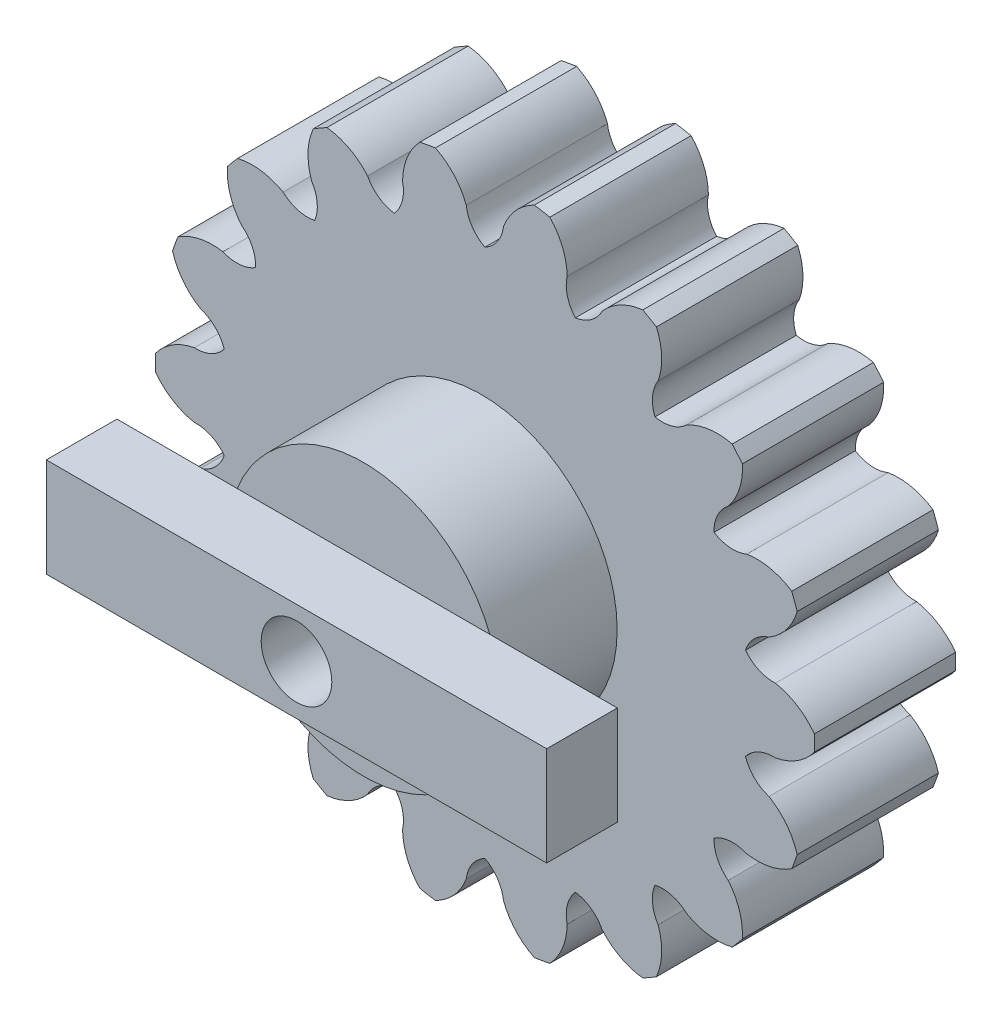
from build123d import *

# Parameters (mm, degrees)
SKETCH1_R           = 14
SKETCH1_R_2         = 1.5
BOSS_EXTRUDE1_DEPTH = 6
CUT_EXTRUDE1_DEPTH  = 6
CIRPATTERN2_COUNT   = 18
SKETCH3_R           = 5.774756077
SKETCH3_R_2         = 1.5
BOSS_EXTRUDE3_DEPTH = 5
SKETCH5_W           = 21.252901625
SKETCH5_H           = 4.204707469
SKETCH5_R           = 1.5
BOSS_EXTRUDE5_DEPTH = 3


with BuildPart() as part:
    # Sketch1 → Boss-Extrude1 (new body)
    with BuildSketch(Plane.XY):
        Circle(SKETCH1_R)
        Circle(SKETCH1_R_2, mode=Mode.SUBTRACT)
    extrude(amount=BOSS_EXTRUDE1_DEPTH)

    # Sketch2 → Cut-Extrude1 (cut)
    with BuildSketch(Plane.XY):
        with BuildLine():
            ThreePointArc((0, 11.241603953), (0.535784114, 11.719891388), (0.79, 12.391603953))
            ThreePointArc((0.79, 12.391603953), (1.307025272, 13.241256983), (2.1, 13.841603953))
            ThreePointArc((2.1, 13.841603953), (0, 14), (-2.1, 13.841603953))
            ThreePointArc((-2.1, 13.841603953), (-1.307025272, 13.241256983), (-0.79, 12.391603953))
            ThreePointArc((-0.79, 12.391603953), (-0.535784114, 11.719891388), (0, 11.241603953))
        make_face()
    cut_extrude1 = extrude(amount=CUT_EXTRUDE1_DEPTH, mode=Mode.SUBTRACT)

    # CirPattern2: Cut-Extrude1 ×18 about axis
    cirpattern2_axis = Axis((0, 0, 6), (0, 0, -1))
    for i in range(1, CIRPATTERN2_COUNT):
        add(cut_extrude1.rotate(cirpattern2_axis, i * 360 / CIRPATTERN2_COUNT), mode=Mode.SUBTRACT)

    # Sketch3 → Boss-Extrude3 (add)
    with BuildSketch(Plane.XY.offset(6)):
        with Locations((-0.153971115, -0.025789679)):
            Circle(SKETCH3_R)
        with Locations((-0.153971115, -0.025789679)):
            Circle(SKETCH3_R_2, mode=Mode.SUBTRACT)
    extrude(amount=BOSS_EXTRUDE3_DEPTH)

    # Sketch5 → Boss-Extrude5 (add)
    with BuildSketch(Plane.XY.offset(11)):
        with Locations((-0.000748345, 0.002006341)):
            Rectangle(SKETCH5_W, SKETCH5_H)
        with Locations((-0.000748345, -0.000347394)):
            Circle(SKETCH5_R, mode=Mode.SUBTRACT)
    extrude(amount=BOSS_EXTRUDE5_DEPTH)


solid = part.part
